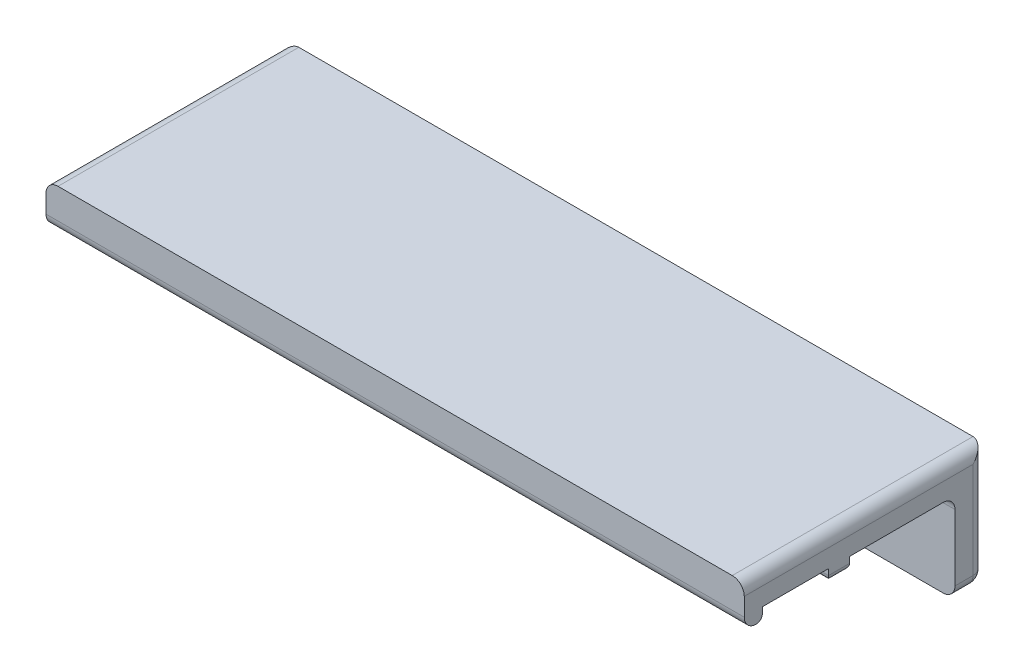
from build123d import *

# Parameters (mm, degrees)
SKETCH1_R           = 2
BOSS_EXTRUDE1_DEPTH = 5
SKETCH2_W           = 116
SKETCH2_H           = 5
BOSS_EXTRUDE2_DEPTH = 35
SKETCH3_W           = 116
SKETCH3_H           = 3
SKETCH3_H_2         = 3.5
BOSS_EXTRUDE3_DEPTH = 2
FILLET1_R           = 2
FILLET2_R           = 1
FILLET3_R           = 2


with BuildPart() as part:
    # Sketch1 → Boss-Extrude1 (new body)
    with BuildSketch(Plane.XY):
        with BuildLine():
            Line((2, 0), (114, 0))
            ThreePointArc((114, 0), (115.414213562, 0.585786438), (116, 2))
            Line((116, 2), (116, 20))
            Line((116, 20), (0, 20))
            Line((0, 20), (0, 2))
            ThreePointArc((0, 2), (0.585786438, 0.585786438), (2, 0))
        make_face()
        with Locations((20, 9)):
            Circle(SKETCH1_R, mode=Mode.SUBTRACT)
        with Locations((96, 9)):
            Circle(SKETCH1_R, mode=Mode.SUBTRACT)
    extrude(amount=BOSS_EXTRUDE1_DEPTH)

    # Sketch2 → Boss-Extrude2 (add)
    with BuildSketch(Plane.XY.offset(5)):
        with Locations((58, 17.5)):
            Rectangle(SKETCH2_W, SKETCH2_H)
    extrude(amount=BOSS_EXTRUDE2_DEPTH)

    # Sketch3 → Boss-Extrude3 (add)
    with BuildSketch(Plane.XZ.offset(-15)):
        with Locations((58, 38.5)):
            Rectangle(SKETCH3_W, SKETCH3_H)
        with Locations((58, 24.25)):
            Rectangle(SKETCH3_W, SKETCH3_H_2)
    extrude(amount=BOSS_EXTRUDE3_DEPTH)

    # Fillet1
    fillet1_edges = [part.edges().sort_by_distance(p)[0] for p in [
        (0, 20, 20),
        (116, 20, 20),
        (58, 13, 40),
        (115.414213562, 0.585786438, 0),
        (58, 0, 0),
        (0.585786438, 0.585786438, 0),
        (0, 11, 0),
        (116, 11, 0),
    ]]
    fillet(fillet1_edges, radius=FILLET1_R)

    # Fillet2
    fillet2_edges = [part.edges().sort_by_distance(p)[0] for p in [
        (58, 13, 26),
        (116, 13, 24.25),
        (58, 13, 22.5),
        (0, 13, 24.25),
        (58, 13, 37),
    ]]
    fillet(fillet2_edges, radius=FILLET2_R - 0.0001)  # a hair under: the kernel refuses the full size

    # Fillet3
    fillet3_edges = [part.edges().sort_by_distance(p)[0] for p in [
        (58, 15, 5),
    ]]
    fillet(fillet3_edges, radius=FILLET3_R)


solid = part.part
